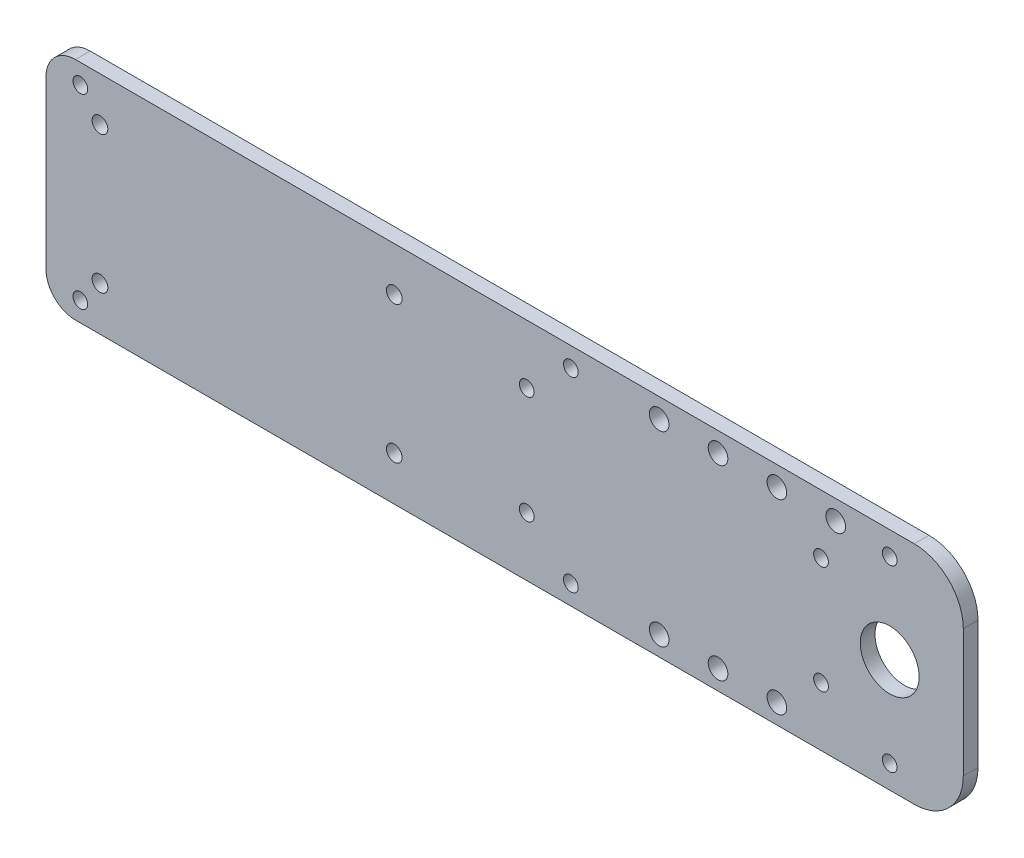
from build123d import *

# Parameters (mm, degrees)
BOSS_EXTRUDE1_OUTLINE_W   = 142
BOSS_EXTRUDE1_OUTLINE_H   = 46
BOSS_EXTRUDE1_OUTLINE_R   = 1.6
BOSS_EXTRUDE1_OUTLINE_R_2 = 1.5
BOSS_EXTRUDE1_DEPTH       = 3
FILLET4_R                 = 6
SKETCH3_R                 = 2
SKETCH3_R_2               = 1.5
BOSS_EXTRUDE2_DEPTH       = 3
SKETCH3_7_R               = 1.5
SKETCH3_7_R_2             = 2
CUT_EXTRUDE1_DEPTH        = 3
FILLET5_R                 = 10
SKETCH2_3_R               = 1.5
CUT_EXTRUDE2_DEPTH        = 10


# Read off the part's stored shape, not the designer's step: Boss-Extrude1
with BuildPart() as part:
    # Boss-Extrude1 outline → Boss-Extrude1 (new body)
    with BuildSketch(Plane.XY):
        with Locations((15, 0)):
            Rectangle(BOSS_EXTRUDE1_OUTLINE_W, BOSS_EXTRUDE1_OUTLINE_H)
        with Locations((-45, -14)):
            Circle(BOSS_EXTRUDE1_OUTLINE_R, mode=Mode.SUBTRACT)
        with Locations((15, -14)):
            Circle(BOSS_EXTRUDE1_OUTLINE_R, mode=Mode.SUBTRACT)
        with Locations((42, -11)):
            Circle(BOSS_EXTRUDE1_OUTLINE_R_2, mode=Mode.SUBTRACT)
        with Locations((-45, 14)):
            Circle(BOSS_EXTRUDE1_OUTLINE_R, mode=Mode.SUBTRACT)
        with Locations((42, 11)):
            Circle(BOSS_EXTRUDE1_OUTLINE_R_2, mode=Mode.SUBTRACT)
        with Locations((15, 14)):
            Circle(BOSS_EXTRUDE1_OUTLINE_R, mode=Mode.SUBTRACT)
    extrude(amount=BOSS_EXTRUDE1_DEPTH)

    # Fillet4
    fillet4_edges = [part.edges().sort_by_distance(p)[0] for p in [
        (-56, -23, 1.5),
        (-56, 23, 1.5),
    ]]
    fillet(fillet4_edges, radius=FILLET4_R)

    # Sketch3 → Boss-Extrude2 (add)
    with BuildSketch(Plane.XY.offset(3)):
        Polygon((131, -23), (131, 23), (86, 23), (86, -19), (86, -23), align=None)
        with Locations((93, -19)):
            Circle(SKETCH3_R, mode=Mode.SUBTRACT)
        with Locations((116, -18.25)):
            Circle(SKETCH3_R_2, mode=Mode.SUBTRACT)
        with BuildLine():
            ThreePointArc((110, 0), (120.242640687, 4.242640687), (116, -6))
            ThreePointArc((116, -6), (111.757359313, -4.242640687), (110, 0))
        make_face(mode=Mode.SUBTRACT)
        with Locations((105, 19)):
            Circle(SKETCH3_R, mode=Mode.SUBTRACT)
        with Locations((116, 18.25)):
            Circle(SKETCH3_R_2, mode=Mode.SUBTRACT)
        with Locations((93, 19)):
            Circle(SKETCH3_R, mode=Mode.SUBTRACT)
    extrude(amount=-BOSS_EXTRUDE2_DEPTH)

    # Sketch3<7> → Cut-Extrude1 (cut)
    with BuildSketch(Plane.XY.offset(3)):
        with Locations((51, 19)):
            Circle(SKETCH3_7_R)
        with Locations((-49, 19)):
            Circle(SKETCH3_7_R)
        with Locations((69, -19)):
            Circle(SKETCH3_7_R_2)
        with Locations((81, -19)):
            Circle(SKETCH3_7_R_2)
        with Locations((69, 19)):
            Circle(SKETCH3_7_R_2)
        with Locations((81, 19)):
            Circle(SKETCH3_7_R_2)
        with Locations((-49, -19)):
            Circle(SKETCH3_7_R)
        with Locations((51, -19)):
            Circle(SKETCH3_7_R)
    extrude(amount=-CUT_EXTRUDE1_DEPTH, mode=Mode.SUBTRACT)

    # Fillet5
    fillet5_edges = [part.edges().sort_by_distance(p)[0] for p in [
        (131, 23, 1.5),
        (131, -23, 1.5),
    ]]
    fillet(fillet5_edges, radius=FILLET5_R)

    # Sketch2<3> → Cut-Extrude2 (cut)
    with BuildSketch(Plane.XY):
        with Locations((102, 11)):
            Circle(SKETCH2_3_R)
        with Locations(Location((102, -11, 0), (0, 0, 180))):
            Circle(SKETCH2_3_R)
    extrude(amount=CUT_EXTRUDE2_DEPTH, mode=Mode.SUBTRACT)


solid = part.part
